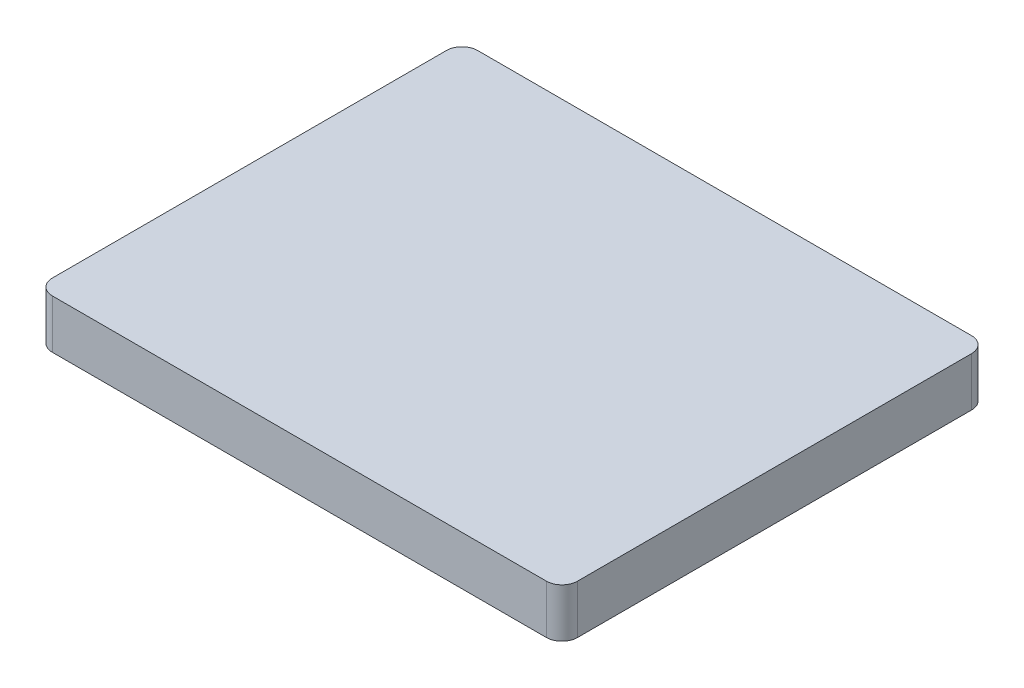
from build123d import *

# Parameters (mm, degrees)
F_611DOWN_1_START       = 19
F_611DOWN_1_DEPTH       = 1.2
F_611DOWN_1_START_2     = 18
F_611DOWN_1_2_OUTLINE_W = 22.362511336
F_611DOWN_1_2_OUTLINE_H = 15.04
F_611DOWN_1_2_DEPTH     = 1
SKETCH_1_W              = 22.362511336
SKETCH_1_H              = 15.04
EXTRUDE_1_DEPTH         = 1


# Read off the part's stored shape, not the designer's step: 基体零件-611Down-1
with BuildPart() as part:
    # 基体零件-611Down-1 outline → 基体零件-611Down-1 (new body)
    with BuildSketch(Plane(origin=(0, 0, 0), x_dir=(1, 0, 0), z_dir=(0, 1, 0)).offset(F_611DOWN_1_START)):
        with BuildLine():
            Line((-11.375, -9.075), (10.875, -9.075))
            ThreePointArc((10.875, -9.075), (11.369974747, -8.869974747), (11.575, -8.375))
            Line((11.575, -8.375), (11.575, 9.375))
            ThreePointArc((11.575, 9.375), (11.369974747, 9.869974747), (10.875, 10.075))
            Line((10.875, 10.075), (-11.375, 10.075))
            ThreePointArc((-11.375, 10.075), (-11.869974747, 9.869974747), (-12.075, 9.375))
            Line((-12.075, 9.375), (-12.075, -8.375))
            ThreePointArc((-12.075, -8.375), (-11.869974747, -8.869974747), (-11.375, -9.075))
        make_face()
    extrude(amount=F_611DOWN_1_DEPTH)

    # 611Down-1 2 outline → 611Down-1 2 (add)
    with BuildSketch(Plane(origin=(0, 0, 0), x_dir=(1, 0, 0), z_dir=(0, 1, 0)).offset(F_611DOWN_1_START_2)):
        with BuildLine():
            Line((-11.375, -9.075), (10.875, -9.075))
            ThreePointArc((10.875, -9.075), (11.369974747, -8.869974747), (11.575, -8.375))
            Line((11.575, -8.375), (11.575, 9.375))
            ThreePointArc((11.575, 9.375), (11.369974747, 9.869974747), (10.875, 10.075))
            Line((10.875, 10.075), (-11.375, 10.075))
            ThreePointArc((-11.375, 10.075), (-11.869974747, 9.869974747), (-12.075, 9.375))
            Line((-12.075, 9.375), (-12.075, -8.375))
            ThreePointArc((-12.075, -8.375), (-11.869974747, -8.869974747), (-11.375, -9.075))
        make_face()
        with Locations((0.106278341, -0.002552009)):
            Rectangle(F_611DOWN_1_2_OUTLINE_W, F_611DOWN_1_2_OUTLINE_H, mode=Mode.SUBTRACT)
    extrude(amount=F_611DOWN_1_2_DEPTH)

    # 草图1 → 凸台-拉伸1 (add)
    with BuildSketch(Plane.XZ.offset(-18)):
        with Locations((0.106278341, 0.002552009)):
            Rectangle(SKETCH_1_W, SKETCH_1_H)
    extrude(amount=-EXTRUDE_1_DEPTH)


solid = part.part
